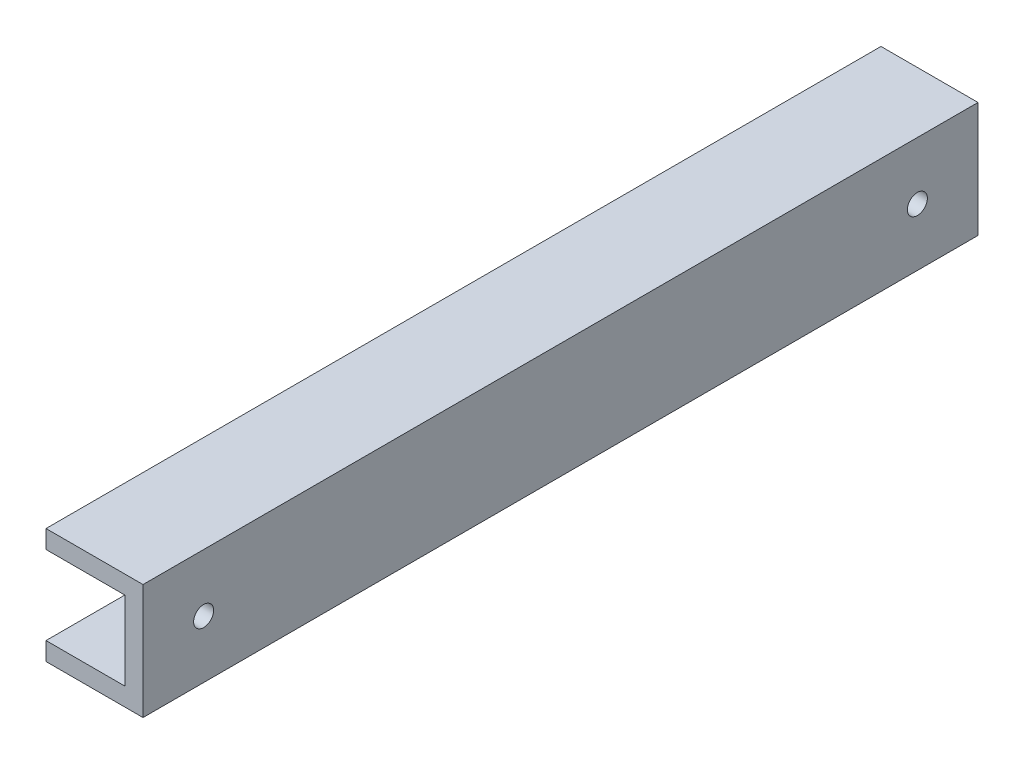
from build123d import *

# Parameters (mm, degrees)
SKETCH_1_W          = 19
SKETCH_1_H          = 19
SKETCH_1_W_2        = 13
SKETCH_1_H_2        = 13
EXTRUDE_1_DEPTH     = 137.7
SKETCH_2_R          = 1.65
CUT_EXTRUDE_1_DEPTH = 30
SKETCH_3_W          = 184.332972064
SKETCH_3_H          = 39.863215684
CUT_EXTRUDE_2_DEPTH = 3
SKETCH_4_W          = 5
SKETCH_4_H          = 13
EXTRUDE_1_2_DEPTH   = 10
SKETCH_5_W          = 81.7
SKETCH_5_H          = 5
EXTRUDE_2_DEPTH     = 10
SKETCH_6_W          = 91.7
SKETCH_6_H          = 13
EXTRUDE_3_DEPTH     = 10
SKETCH_8_W          = 91.7
SKETCH_8_H          = 5
CUT_EXTRUDE_3_DEPTH = 3
CHAMFER_1_SIZE      = 3
CHAMFER_2_SIZE      = 4


with BuildPart() as part:
    # 草图1 → Extrude 1 (new body)
    with BuildSketch(Plane.XY):
        with Locations((6.5, 6.5)):
            Rectangle(SKETCH_1_W, SKETCH_1_H)
        with Locations((6.5, 6.5)):
            Rectangle(SKETCH_1_W_2, SKETCH_1_H_2, mode=Mode.SUBTRACT)
    extrude(amount=EXTRUDE_1_DEPTH)

    # 草图2 → 切除-拉伸1 (cut)
    with BuildSketch(Plane.ZY.offset(3)):
        with Locations((10, 6.5)):
            Circle(SKETCH_2_R)
        with Locations((127.7, 6.5)):
            Circle(SKETCH_2_R)
    extrude(amount=-CUT_EXTRUDE_1_DEPTH, mode=Mode.SUBTRACT)

    # 草图3 → 切除-拉伸2 (cut)
    with BuildSketch(Plane.ZY.offset(3)):
        with Locations((86.871134348, 3.380889782)):
            Rectangle(SKETCH_3_W, SKETCH_3_H)
    extrude(amount=-CUT_EXTRUDE_2_DEPTH, mode=Mode.SUBTRACT)

    # 草图4 → Extrude 1 2 (add)
    with BuildSketch(Plane.ZY.offset(-13)):
        with Locations((25.5, 6.5)):
            Rectangle(SKETCH_4_W, SKETCH_4_H)
        with Locations((112.2, 6.5)):
            Rectangle(SKETCH_4_W, SKETCH_4_H)
    extrude(amount=EXTRUDE_1_2_DEPTH)

    # 草图5 → 凸台-拉伸2 (add)
    with BuildSketch(Plane.ZY.offset(-13)):
        with Locations((68.85, 6.5)):
            Rectangle(SKETCH_5_W, SKETCH_5_H)
    extrude(amount=EXTRUDE_2_DEPTH)

    # 草图6 → 凸台-拉伸3 (add)
    with BuildSketch(Plane.ZY.offset(-13)):
        with Locations((68.85, 6.5)):
            Rectangle(SKETCH_6_W, SKETCH_6_H)
    extrude(amount=EXTRUDE_3_DEPTH)

    # 草图8 → 切除-拉伸3 (cut)
    with BuildSketch(Plane.ZY.offset(-3)):
        with Locations((68.85, 6.5)):
            Rectangle(SKETCH_8_W, SKETCH_8_H)
    extrude(amount=-CUT_EXTRUDE_3_DEPTH, mode=Mode.SUBTRACT)

    # 倒角1
    chamfer_1_edges = [part.edges().sort_by_distance(p)[0] for p in [
        (6, 6.5, 23),
        (6, 6.5, 114.7),
    ]]
    chamfer(chamfer_1_edges, length=CHAMFER_1_SIZE)

    # 倒角2
    chamfer_2_edges = [part.edges().sort_by_distance(p)[0] for p in [
        (13, 6.5, 23),
        (13, 6.5, 114.7),
    ]]
    chamfer(chamfer_2_edges, length=CHAMFER_2_SIZE - 0.0001)  # a hair under: the kernel refuses the full size


solid = part.part
